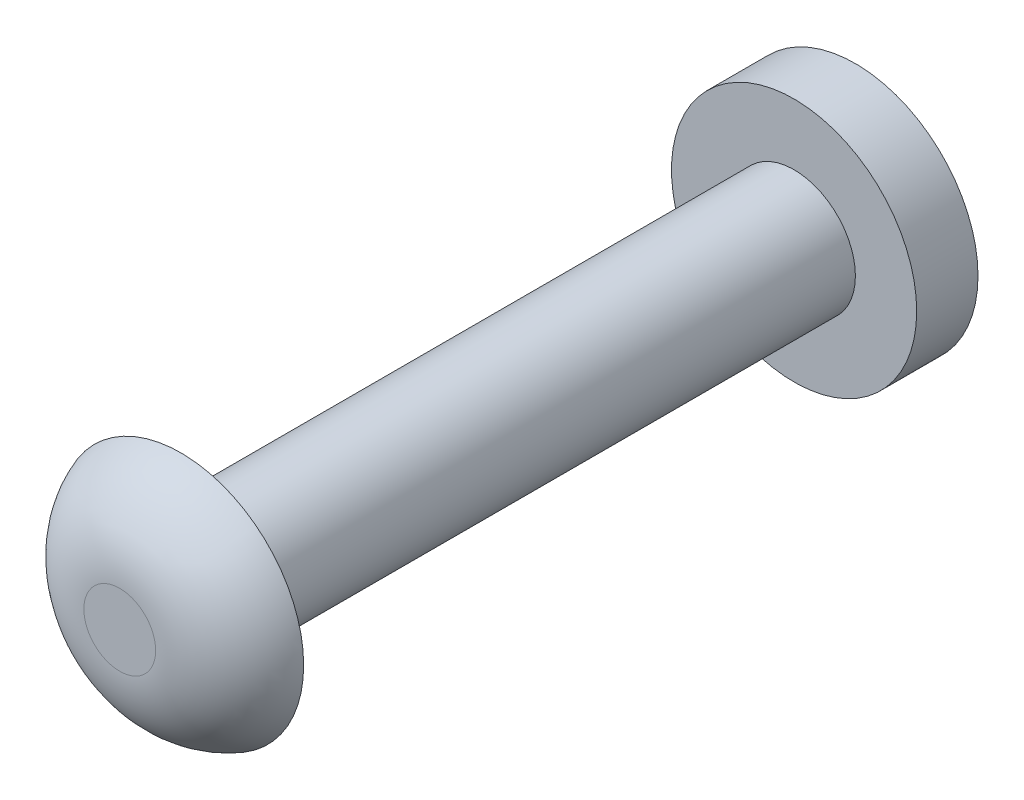
from build123d import *

# Parameters (mm, degrees)
SKETCH1_R           = 5
BOSS_EXTRUDE1_DEPTH = 25
SKETCH2_R           = 10
BOSS_EXTRUDE2_DEPTH = 5
FILLET1_R           = 7.5


with BuildPart() as part:
    # Sketch1 → Boss-Extrude1 (new, symmetric)
    with BuildSketch(Plane.XY):
        Circle(SKETCH1_R)
    extrude(amount=BOSS_EXTRUDE1_DEPTH, both=True)

    # Sketch2 → Boss-Extrude2 (add)
    with BuildSketch(Plane.XY.offset(25)):
        Circle(SKETCH2_R)
    boss_extrude2 = extrude(amount=BOSS_EXTRUDE2_DEPTH)

    # Mirror1: Boss-Extrude2 across plane
    add(boss_extrude2.mirror(Plane.XY))

    # Fillet1
    # the kernel refuses this fillet: 7.5 mm, written as the material it takes off along each edge
    with BuildSketch(Plane(origin=(0, 0, 30), x_dir=(1, 0, 0), z_dir=(0, -1, 0))) as fillet1_piece_1:
        with BuildLine():
            CenterArc((2.928932188, -7.5), FILLET1_R, 19.471220634, 70.528779366)
            Line((2.928932188, 0), (2.928932188, 0.15))
            Line((2.928932188, 0.15), (10, 0.15))
            Line((10, 0.15), (10.15, 0))
            ThreePointArc((10.15, 0), (10.15, -2.5), (10.141421356, -4.95))
            Line((10.141421356, -4.95), (10, -5))
        make_face()
    revolve(axis=Axis((0, 0, 30), (0, 0, 1)), mode=Mode.SUBTRACT)


solid = part.part
